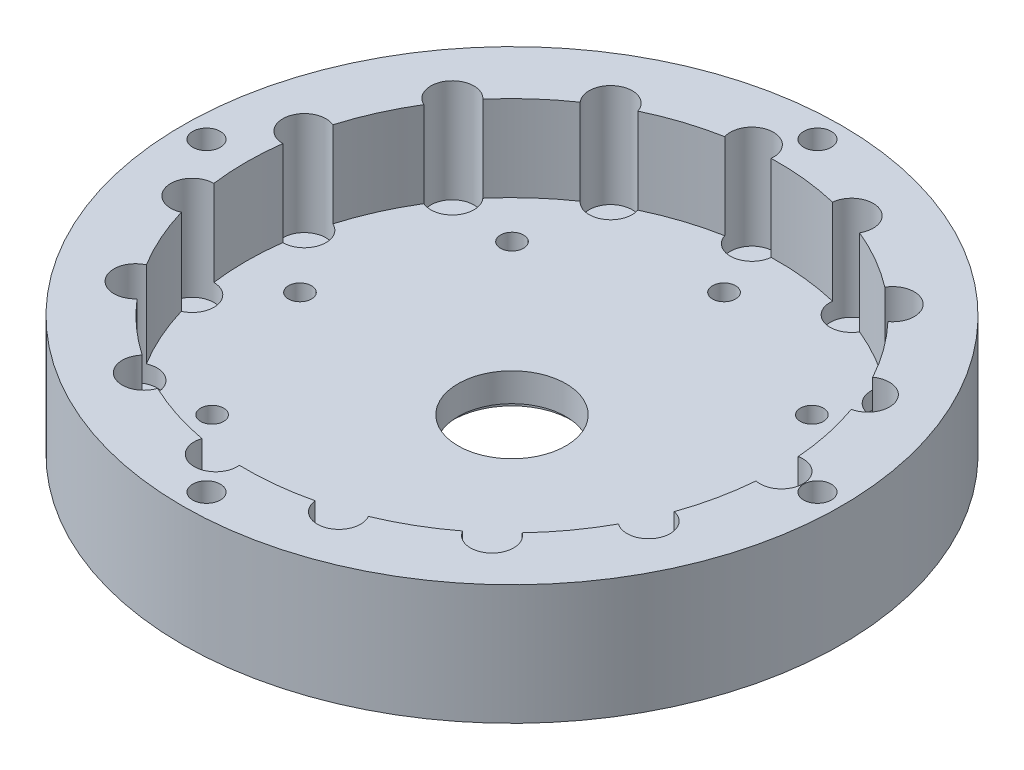
from build123d import *

# Parameters (mm, degrees)
SKETCH1_R           = 45.85
SKETCH1_R_2         = 1.5635
SKETCH1_R_3         = 7.5
BOSS_EXTRUDE1_DEPTH = 4.7625
SKETCH1_6_R         = 3
SKETCH1_6_R_2       = 1.607
CUT_EXTRUDE1_DEPTH  = 2.4105
BOSS_EXTRUDE2_START = 11.9355
SKETCH1_7_R         = 45.85
SKETCH1_7_R_2       = 1.5635
BOSS_EXTRUDE2_DEPTH = 11.9355
SKETCH2_R           = 1.925
CUT_EXTRUDE2_DEPTH  = 4
CUT_EXTRUDE3_START  = -3.9625
SKETCH1_8_R         = 8.25
SKETCH1_8_R_2       = 7.5
CUT_EXTRUDE3_DEPTH  = 0.8


with BuildPart() as part:
    # Sketch1 → Boss-Extrude1 (new body)
    with BuildSketch(Plane(origin=(0, 0, 0), x_dir=(1, 0, 0), z_dir=(0, 1, 0))):
        Circle(SKETCH1_R)
        with Locations((0, -42.5)):
            Circle(SKETCH1_R_2, mode=Mode.SUBTRACT)
        with Locations((-42.5, 0)):
            Circle(SKETCH1_R_2, mode=Mode.SUBTRACT)
        with Locations((42.5, 0)):
            Circle(SKETCH1_R_2, mode=Mode.SUBTRACT)
        with Locations((0, 42.5)):
            Circle(SKETCH1_R_2, mode=Mode.SUBTRACT)
        Circle(SKETCH1_R_3, mode=Mode.SUBTRACT)
    extrude(amount=-BOSS_EXTRUDE1_DEPTH)

    # Sketch1<6> → Cut-Extrude1 (cut)
    with BuildSketch(Plane(origin=(0, 0, 0), x_dir=(1, 0, 0), z_dir=(0, 1, 0))):
        with Locations((37.5, 0)):
            Circle(SKETCH1_6_R)
        with Locations((34.257954662, 15.252624115)):
            Circle(SKETCH1_6_R)
        with Locations((34.257954662, -15.252624115)):
            Circle(SKETCH1_6_R)
        with Locations((25.092397738, 27.867930955)):
            Circle(SKETCH1_6_R)
        with Locations((25.092397738, -27.867930955)):
            Circle(SKETCH1_6_R)
        with Locations((11.588137289, 35.664619361)):
            Circle(SKETCH1_6_R)
        with Locations((11.588137289, -35.664619361)):
            Circle(SKETCH1_6_R)
        with Locations((-3.919817373, 37.294571076)):
            Circle(SKETCH1_6_R)
        with Locations((-3.919817373, -37.294571076)):
            Circle(SKETCH1_6_R)
        with Locations((-18.75, 32.475952642)):
            Circle(SKETCH1_6_R)
        with Locations((-18.75, -32.475952642)):
            Circle(SKETCH1_6_R)
        with Locations((-30.338137289, 22.041946961)):
            Circle(SKETCH1_6_R)
        with Locations((-30.338137289, -22.041946961)):
            Circle(SKETCH1_6_R)
        with Locations((-36.680535028, 7.796688406)):
            Circle(SKETCH1_6_R)
        with Locations((-36.680535028, -7.796688406)):
            Circle(SKETCH1_6_R)
        with Locations((29.5, 0)):
            Circle(SKETCH1_6_R_2)
        with Locations((20.859650045, -20.859650045)):
            Circle(SKETCH1_6_R_2)
        with Locations((0, -29.5)):
            Circle(SKETCH1_6_R_2)
        with Locations((-20.859650045, -20.859650045)):
            Circle(SKETCH1_6_R_2)
        with Locations((-29.5, 0)):
            Circle(SKETCH1_6_R_2)
        with Locations((-20.859650045, 20.859650045)):
            Circle(SKETCH1_6_R_2)
        with Locations((0, 29.5)):
            Circle(SKETCH1_6_R_2)
        with Locations((20.859650045, 20.859650045)):
            Circle(SKETCH1_6_R_2)
    extrude(amount=-CUT_EXTRUDE1_DEPTH, mode=Mode.SUBTRACT)

    # Sketch1<7> → Boss-Extrude2 (add)
    with BuildSketch(Plane(origin=(0, 0, 0), x_dir=(1, 0, 0), z_dir=(0, 1, 0)).offset(BOSS_EXTRUDE2_START)):
        Circle(SKETCH1_7_R)
        with Locations((0, -42.5)):
            Circle(SKETCH1_7_R_2, mode=Mode.SUBTRACT)
        with Locations((-42.5, 0)):
            Circle(SKETCH1_7_R_2, mode=Mode.SUBTRACT)
        with Locations((42.5, 0)):
            Circle(SKETCH1_7_R_2, mode=Mode.SUBTRACT)
        with BuildLine():
            ThreePointArc((36.883333333, 2.935936345), (39.39076704, 2.32916294), (40.5, 0))
            ThreePointArc((40.5, 0), (39.39076704, -2.32916294), (36.883333333, -2.935936345))
            ThreePointArc((36.883333333, -2.935936345), (36.191461227, -7.69273256), (34.888754523, -12.319691873))
            ThreePointArc((34.888754523, -12.319691873), (36.59166411, -13.367471546), (37.257954662, -15.252624115))
            ThreePointArc((37.257954662, -15.252624115), (35.6231437, -17.924001829), (32.500448736, -17.683914497))
            ThreePointArc((32.500448736, -17.683914497), (29.933628792, -21.748054335), (26.861593101, -25.445133446))
            ThreePointArc((26.861593101, -25.445133446), (27.767055295, -26.50917897), (28.092397738, -27.867930955))
            ThreePointArc((28.092397738, -27.867930955), (25.872343464, -30.764771418), (22.497941295, -29.37418318))
            ThreePointArc((22.497941295, -29.37418318), (18.5, -32.04293994), (14.189818202, -34.170880284))
            ThreePointArc((14.189818202, -34.170880284), (14.486847583, -34.891651942), (14.588137289, -35.664619361))
            ThreePointArc((14.588137289, -35.664619361), (11.748752331, -38.660316744), (8.605335417, -35.985388734))
            ThreePointArc((8.605335417, -35.985388734), (3.867553141, -36.797310129), (-0.935505175, -36.988171489))
            ThreePointArc((-0.935505175, -36.988171489), (-0.92374189, -37.141170608), (-0.919817373, -37.294571076))
            ThreePointArc((-0.919817373, -37.294571076), (-4.385552663, -40.258199029), (-6.775211132, -36.37439366))
            ThreePointArc((-6.775211132, -36.37439366), (-11.433628792, -35.189091103), (-15.899071208, -33.409871815))
            ThreePointArc((-15.899071208, -33.409871815), (-20.25, -35.074028853), (-20.984262125, -30.47393547))
            ThreePointArc((-20.984262125, -30.47393547), (-24.757832435, -27.496358543), (-28.113543391, -24.054701786))
            ThreePointArc((-28.113543391, -24.054701786), (-32.765188272, -23.805302718), (-31.564943561, -19.304256991))
            ThreePointArc((-31.564943561, -19.304256991), (-33.801181933, -15.049255794), (-35.466928517, -10.540255288))
            ThreePointArc((-35.466928517, -10.540255288), (-39.61497783, -8.420423478), (-36.687759497, -4.796697105))
            ThreePointArc((-36.687759497, -4.796697105), (-37, 0), (-36.687759497, 4.796697105))
            ThreePointArc((-36.687759497, 4.796697105), (-39.61497783, 8.420423478), (-35.466928517, 10.540255288))
            ThreePointArc((-35.466928517, 10.540255288), (-33.801181933, 15.049255794), (-31.564943561, 19.304256991))
            ThreePointArc((-31.564943561, 19.304256991), (-32.765188272, 23.805302718), (-28.113543391, 24.054701786))
            ThreePointArc((-28.113543391, 24.054701786), (-24.757832435, 27.496358543), (-20.984262125, 30.47393547))
            ThreePointArc((-20.984262125, 30.47393547), (-20.25, 35.074028853), (-15.899071208, 33.409871815))
            ThreePointArc((-15.899071208, 33.409871815), (-11.433628792, 35.189091103), (-6.775211132, 36.37439366))
            ThreePointArc((-6.775211132, 36.37439366), (-4.385552663, 40.258199029), (-0.919817373, 37.294571076))
            ThreePointArc((-0.919817373, 37.294571076), (-0.92374189, 37.141170608), (-0.935505175, 36.988171489))
            ThreePointArc((-0.935505175, 36.988171489), (3.867553141, 36.797310129), (8.605335417, 35.985388734))
            ThreePointArc((8.605335417, 35.985388734), (11.748752331, 38.660316744), (14.588137289, 35.664619361))
            ThreePointArc((14.588137289, 35.664619361), (14.486847583, 34.891651942), (14.189818202, 34.170880284))
            ThreePointArc((14.189818202, 34.170880284), (18.5, 32.04293994), (22.497941295, 29.37418318))
            ThreePointArc((22.497941295, 29.37418318), (25.872343464, 30.764771418), (28.092397738, 27.867930955))
            ThreePointArc((28.092397738, 27.867930955), (27.767055295, 26.50917897), (26.861593101, 25.445133446))
            ThreePointArc((26.861593101, 25.445133446), (29.933628792, 21.748054335), (32.500448736, 17.683914497))
            ThreePointArc((32.500448736, 17.683914497), (35.6231437, 17.924001829), (37.257954662, 15.252624115))
            ThreePointArc((37.257954662, 15.252624115), (36.59166411, 13.367471546), (34.888754523, 12.319691873))
            ThreePointArc((34.888754523, 12.319691873), (36.191461227, 7.69273256), (36.883333333, 2.935936345))
        make_face(mode=Mode.SUBTRACT)
        with Locations((0, 42.5)):
            Circle(SKETCH1_7_R_2, mode=Mode.SUBTRACT)
    extrude(amount=-BOSS_EXTRUDE2_DEPTH)

    # Sketch2 → Cut-Extrude2 (cut)
    with BuildSketch(Plane(origin=(0, 11.9355, 0), x_dir=(1, 0, 0), z_dir=(0, 1, 0))):
        with Locations((-42.5, 0)):
            Circle(SKETCH2_R)
        with Locations((0, 42.5)):
            Circle(SKETCH2_R)
        with Locations((42.5, 0)):
            Circle(SKETCH2_R)
        with Locations((0, -42.5)):
            Circle(SKETCH2_R)
    extrude(amount=-CUT_EXTRUDE2_DEPTH, mode=Mode.SUBTRACT)

    # Sketch1<8> → Cut-Extrude3 (cut)
    with BuildSketch(Plane(origin=(0, 0, 0), x_dir=(1, 0, 0), z_dir=(0, 1, 0)).offset(CUT_EXTRUDE3_START)):
        Circle(SKETCH1_8_R)
        Circle(SKETCH1_8_R_2, mode=Mode.SUBTRACT)
    extrude(amount=-CUT_EXTRUDE3_DEPTH, mode=Mode.SUBTRACT)


solid = part.part
